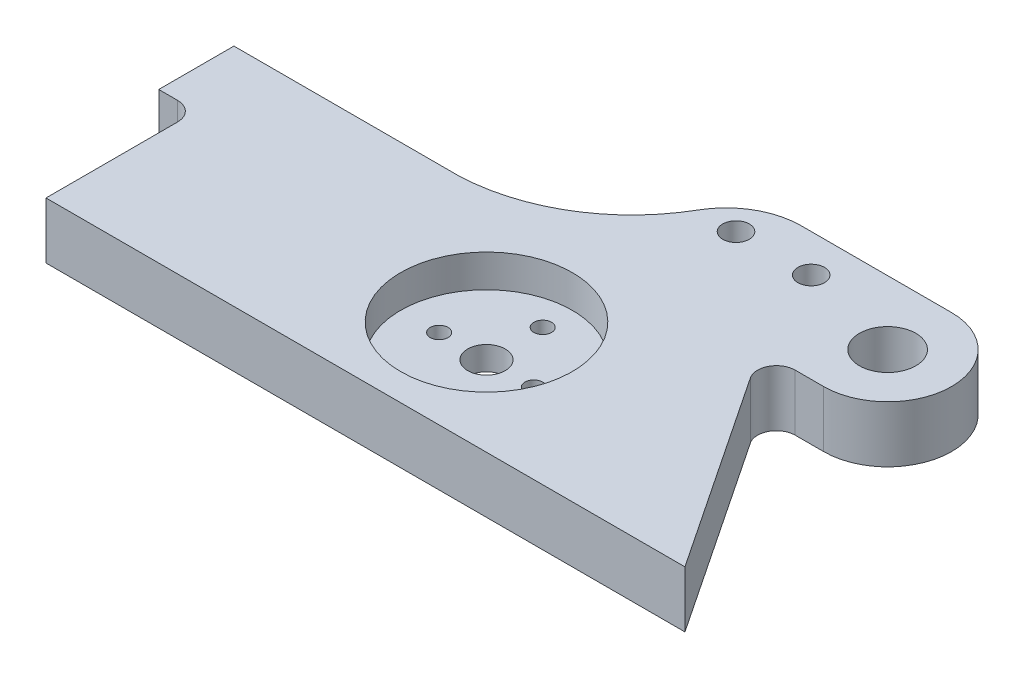
from build123d import *

# Parameters (mm, degrees)
SKETCH1_R           = 4.7625
SKETCH1_R_2         = 2.2479
SKETCH1_R_3         = 1.5
SKETCH1_R_4         = 3.175
BOSS_EXTRUDE1_DEPTH = 9.525
FILLET1_R           = 3.175
FILLET2_R           = 3.175
SKETCH2_R           = 14.5
CUT_EXTRUDE1_DEPTH  = 5.525


with BuildPart() as part:
    # Sketch1 → Boss-Extrude1 (new body)
    with BuildSketch(Plane(origin=(0, 0, 0), x_dir=(1, 0, 0), z_dir=(0, 1, 0))):
        with BuildLine():
            Line((0, 0), (38.1, 0))
            ThreePointArc((38.1, 0), (52.620300687, 4.403064286), (63.218539249, 15.261399634))
            ThreePointArc((63.218539249, 15.261399634), (67.86863694, 19.924564568), (74.228922018, 21.631986448))
            Line((74.228922018, 21.631986448), (99.628922018, 21.631986448))
            ThreePointArc((99.628922018, 21.631986448), (110.444915242, 10.815993224), (99.628922018, 0))
            Line((99.628922018, 0), (88.9, 0))
            Line((88.9, 0), (114.3, -38.1))
            Line((114.3, -38.1), (6.35, -38.1))
            Line((6.35, -38.1), (6.35, -12.7))
            Line((6.35, -12.7), (0, -12.7))
            Line((0, -12.7), (0, 0))
        make_face()
        with Locations((99.628922018, 10.815993224)):
            Circle(SKETCH1_R, mode=Mode.SUBTRACT)
        with Locations((69.568539249, 15.261399634)):
            Circle(SKETCH1_R_2, mode=Mode.SUBTRACT)
        with Locations((82.268539249, 15.261399634)):
            Circle(SKETCH1_R_2, mode=Mode.SUBTRACT)
        with Locations((69.720479044, -19.05)):
            Circle(SKETCH1_R_3, mode=Mode.SUBTRACT)
        with Locations((61.720479044, -28.55)):
            Circle(SKETCH1_R_3, mode=Mode.SUBTRACT)
        with Locations((53.720479044, -19.05)):
            Circle(SKETCH1_R_3, mode=Mode.SUBTRACT)
        with Locations((61.720479044, -9.55)):
            Circle(SKETCH1_R_3, mode=Mode.SUBTRACT)
        with Locations((61.720479044, -19.05)):
            Circle(SKETCH1_R_4, mode=Mode.SUBTRACT)
    extrude(amount=BOSS_EXTRUDE1_DEPTH)

    # Fillet1
    fillet1_edges = [part.edges().sort_by_distance(p)[0] for p in [
        (88.9, 4.7625, 0),
    ]]
    fillet(fillet1_edges, radius=FILLET1_R)

    # Fillet2
    fillet2_edges = [part.edges().sort_by_distance(p)[0] for p in [
        (6.35, 4.7625, 12.7),
    ]]
    fillet(fillet2_edges, radius=FILLET2_R)

    # Sketch2 → Cut-Extrude1 (cut)
    with BuildSketch(Plane(origin=(0, 9.525, 0), x_dir=(1, 0, 0), z_dir=(0, 1, 0))):
        with Locations((61.720479044, -19.05)):
            Circle(SKETCH2_R)
    extrude(amount=-CUT_EXTRUDE1_DEPTH, mode=Mode.SUBTRACT)


solid = part.part
